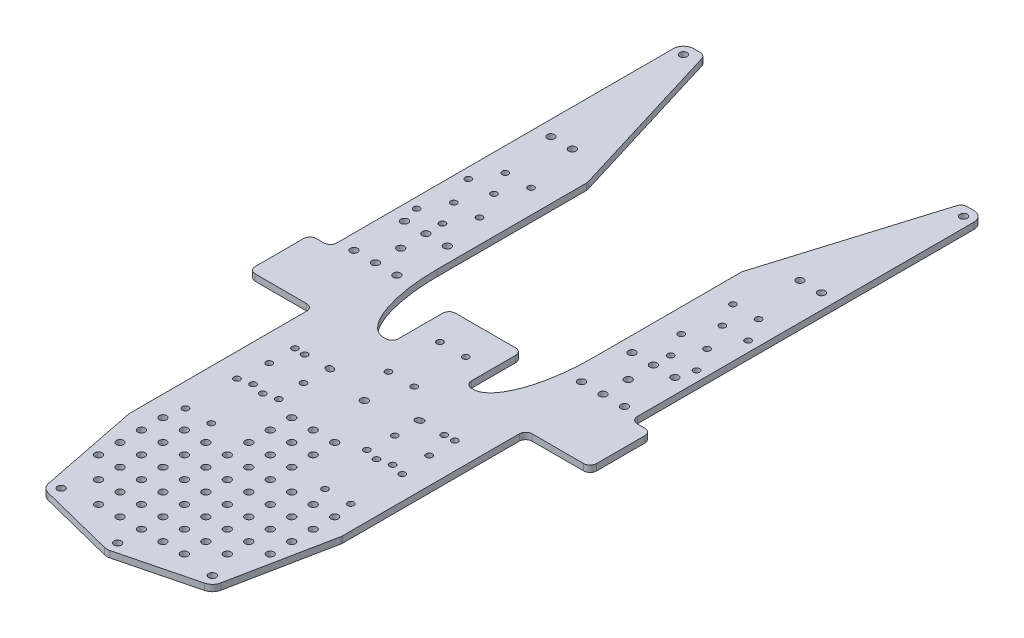
from build123d import *

# Parameters (mm, degrees)
SKETCH4_W              = 200
SKETCH4_H              = 3
BOSS_EXTRUDE1_DEPTH    = 79.5
M2_5_CLEARANCE_HOLE2_D = 2.9
SKETCH14_W             = 9.5
SKETCH14_H             = 85.75
SKETCH14_W_2           = 30
CUT_EXTRUDE1_DEPTH     = 128.785953845
FILLET3_SIZE           = 15
FILLET3_SIZE_2         = 40
BOSS_EXTRUDE2_DEPTH    = 3
M3_CLEARANCE_HOLE1_D   = 3.4
FILLET2_R              = 3
M2_5_CLEARANCE_HOLE1_D = 2.9
M3_CLEARANCE_HOLE2_D   = 3.4
FILLET4_R              = 1


with BuildPart() as part:
    # Sketch4 → Boss-Extrude1 (new body)
    with BuildSketch(Plane(origin=(0, 0, 0), x_dir=(0, 0, -1), z_dir=(1, 0, 0))):
        with Locations((0, -1.5)):
            Rectangle(SKETCH4_W, SKETCH4_H)
    extrude(amount=BOSS_EXTRUDE1_DEPTH)

    # M2.5 Clearance Hole2 (through all)
    with Locations(Plane.XZ.offset(3)):
        with Locations((26.5, 84.75), (38.5, 84.75), (38.5, 60.75), (26.5, 60.75), (59, -84.75), (47, -84.75), (47, -60.75), (59, -60.75), (6, 22.697808823), (6, -1.302191177), (65.2, -73.65), (53.2, -73.65), (53.2, -49.65), (65.2, -49.65)):
            Hole(M2_5_CLEARANCE_HOLE2_D / 2)

    # Sketch14 → Cut-Extrude1 (cut, through all)
    with BuildSketch(Plane(origin=(0, 0, 0), x_dir=(1, 0, 0), z_dir=(0, 1, 0))):
        with Locations((74.75, 57.125)):
            Rectangle(SKETCH14_W, SKETCH14_H)
        with Locations((64.5, -57.125)):
            Rectangle(SKETCH14_W_2, SKETCH14_H)
        Polygon((17, 16.552191177), (17, -10), (36, -10), (36, 100), (0, 100), (0, 16.552191177), align=None)
    extrude(amount=-CUT_EXTRUDE1_DEPTH, mode=Mode.SUBTRACT)

    # Fillet3
    # an asymmetric fillet: 40, 15 mm, written as the material it adds along each edge
    with BuildSketch(Plane(origin=(36, 0, 10), x_dir=(-1, 0, 0), z_dir=(0, -1, 0))) as fillet3_piece_1:
        with BuildLine():
            Bezier((FILLET3_SIZE, 0), (0, 0), (0, FILLET3_SIZE_2), weights=[1, 0.707106781, 1])
            Line((0, FILLET3_SIZE_2), (0, 0))
            Line((0, 0), (FILLET3_SIZE, 0))
        make_face()
    extrude(amount=3)

    # Mirror1: part across plane


with BuildPart() as part_1:
    add(part.part)
    add(part.part.mirror(Plane(origin=(0, 0, 0), x_dir=(0, 0, 1), z_dir=(1, 0, 0))))

    # Sketch18 → Boss-Extrude2 (add)
    with BuildSketch(Plane(origin=(0, 0, 0), x_dir=(1, 0, 0), z_dir=(0, 1, 0))):
        with BuildLine():
            Line((1.227109335, -159.689339409), (36.442706526, -150.773998348))
            ThreePointArc((36.442706526, -150.773998348), (38.839368962, -149.371953218), (40.11850057, -146.907497151))
            Line((40.11850057, -146.907497151), (49.5, -100))
            Line((49.5, -100), (-49.5, -100))
            Line((-49.5, -100), (-40.11850057, -146.907497151))
            ThreePointArc((-40.11850057, -146.907497151), (-38.839368962, -149.371953218), (-36.442706526, -150.773998348))
            Line((-36.442706526, -150.773998348), (-1.227109335, -159.689339409))
            ThreePointArc((-1.227109335, -159.689339409), (0, -159.842257536), (1.227109335, -159.689339409))
        make_face()
        with BuildLine():
            Line((36, 100), (70, 100))
            Line((70, 100), (70, 173.9875))
            ThreePointArc((70, 173.9875), (68.605096045, 177.355096045), (65.2375, 178.75))
            Line((65.2375, 178.75), (60, 178.75))
            Line((60, 178.75), (36, 100))
        make_face()
        with BuildLine():
            Line((-70, 173.9875), (-70, 100))
            Line((-70, 100), (-36, 100))
            Line((-36, 100), (-60, 178.75))
            Line((-60, 178.75), (-65.2375, 178.75))
            ThreePointArc((-65.2375, 178.75), (-68.605096045, 177.355096045), (-70, 173.9875))
        make_face()
    extrude(amount=-BOSS_EXTRUDE2_DEPTH)

    # M3 Clearance Hole1 (through all)
    with Locations(Plane(origin=(0, 0, 0), x_dir=(1, 0, 0), z_dir=(0, 1, 0))):
        with Locations((0, -39.947808823), (0, -154.842257536), (53, 30), (-53, 30), (35.215597191, -145.926916475), (-35.215597191, -145.926916475), (65.2375, 173.9875), (-65.2375, 173.9875)):
            Hole(M3_CLEARANCE_HOLE1_D / 2)

    # Fillet2
    fillet2_edges = [part_1.edges().sort_by_distance(p)[0] for p in [
        (17, -1.5, 10),
        (17, -1.5, -16.552191177),
        (-17, -1.5, -16.552191177),
        (-17, -1.5, 10),
        (-70, -1.5, -14.25),
        (-79.5, -1.5, -14.25),
        (-79.5, -1.5, 14.25),
        (-49.5, -1.5, 14.25),
        (49.5, -1.5, 14.25),
        (79.5, -1.5, 14.25),
        (79.5, -1.5, -14.25),
        (70, -1.5, -14.25),
        (49.5, -1.5, 100),
        (-49.5, -1.5, 100),
        (-36, -1.5, -100),
        (-60, -1.5, -178.75),
        (60, -1.5, -178.75),
        (36, -1.5, -100),
    ]]
    fillet(fillet2_edges, radius=FILLET2_R)

    # M2.5 Clearance Hole1 (through all)
    with Locations(Plane(origin=(0, 0, 0), x_dir=(1, 0, 0), z_dir=(0, 1, 0))):
        with Locations((32.5, -59.25), (20.5, -59.25), (20.5, -35.25), (32.5, -35.25), (-20.5, -35.25), (-32.5, -35.25), (-32.5, -59.25), (-20.5, -59.25), (37.25, -47), (37.25, -35), (21.25, -35), (21.25, -47), (-21.25, -47), (-37.25, -47), (-37.25, -35), (-21.25, -35)):
            Hole(M2_5_CLEARANCE_HOLE1_D / 2)

    # M3 Clearance Hole2 (through all)
    with Locations(Plane(origin=(0, 0, 0), x_dir=(1, 0, 0), z_dir=(0, 1, 0))):
        with Locations((40, -93.75), (30, -93.75), (20, -93.75), (10, -93.75), (0, -93.75), (30, -103.75), (20, -103.75), (10, -103.75), (0, -103.75), (30, -113.75), (20, -113.75), (10, -113.75), (0, -113.75), (30, -123.75), (20, -123.75), (10, -123.75), (0, -123.75), (30, -133.75), (20, -133.75), (10, -133.75), (0, -133.75), (20, -143.75), (10, -143.75), (0, -143.75), (40, -103.75), (40, -113.75), (40, -123.75), (-40, -123.75), (-40, -113.75), (-40, -103.75), (-10, -143.75), (-20, -143.75), (-10, -133.75), (-20, -133.75), (-30, -133.75), (-10, -123.75), (-20, -123.75), (-30, -123.75), (-10, -113.75), (-20, -113.75), (-30, -113.75), (-10, -103.75), (-20, -103.75), (-30, -103.75), (-10, -93.75), (-20, -93.75), (-30, -93.75), (-40, -93.75), (10, -83.75), (0, -83.75), (-10, -83.75), (10, -73.75), (0, -73.75), (-10, -73.75), (10, -63.75), (0, -63.75), (-10, -63.75), (43, 41.75), (63, 41.75), (53, 110), (63, 110), (-63, 110), (-53, 110), (-63, 41.75), (-43, 41.75), (-43, 18.25), (-63, 18.25), (63, 18.25), (43, 18.25), (53, 18.25), (53, 41.75), (-53, 41.75), (-53, 18.25)):
            Hole(M3_CLEARANCE_HOLE2_D / 2)

    # Fillet4
    fillet4_edges = [part_1.edges().sort_by_distance(p)[0] for p in [
        (-21.316163235, -1.5, 36.448489705),
        (-20.433836765, -1.5, 33.801510295),
        (20.433836765, -1.5, 33.801510295),
        (21.316163235, -1.5, 36.448489705),
    ]]
    fillet(fillet4_edges, radius=FILLET4_R)


solid = part_1.part
